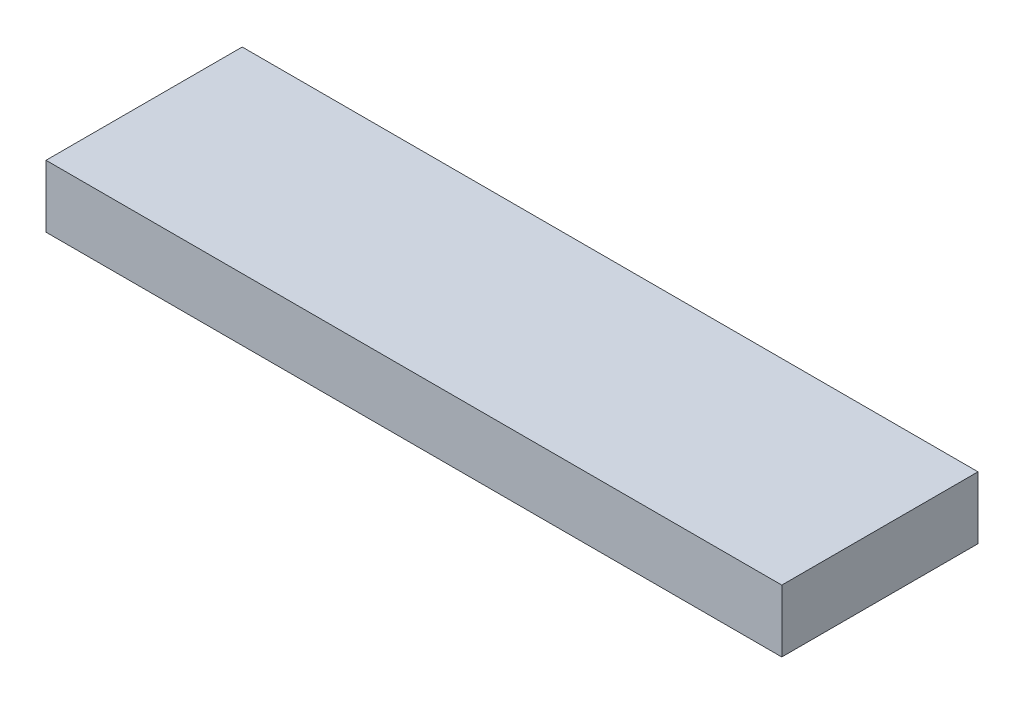
from build123d import *

# Parameters (mm, degrees)
SKETCH1_W           = 40
SKETCH1_H           = 12.7
BOSS_EXTRUDE1_DEPTH = 150


with BuildPart() as part:
    # Sketch1 → Boss-Extrude1 (new body)
    with BuildSketch(Plane(origin=(0, 0, 0), x_dir=(0, 0, -1), z_dir=(1, 0, 0))):
        with Locations((20, 6.35)):
            Rectangle(SKETCH1_W, SKETCH1_H)
    extrude(amount=BOSS_EXTRUDE1_DEPTH)


solid = part.part
